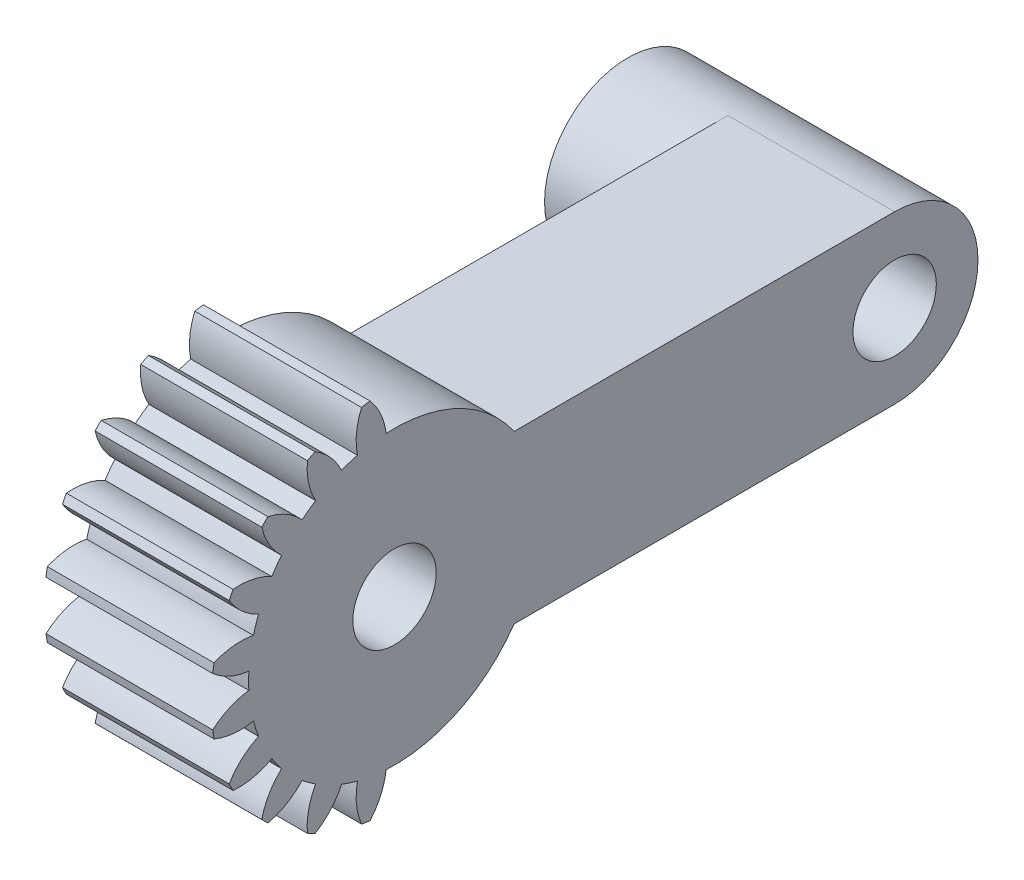
from build123d import *

# Parameters (mm, degrees)
SKETCH1_R           = 2.5
BOSS_EXTRUDE1_DEPTH = 10
SKETCH2_R           = 2.4999999999999947
BOSS_EXTRUDE2_DEPTH = 10
SKETCH3_R           = 5.000000000003233
SKETCH3_R_2         = 2.500000000003231
BOSS_EXTRUDE3_DEPTH = 6
SKETCH4_R           = 2.5
CUT_EXTRUDE1_DEPTH  = 5
SKETCH6_R           = 1.5
CUT_EXTRUDE2_DEPTH  = 40.40067248227502
CUT_EXTRUDE3_START  = -3
SKETCH7_R           = 2.5
CUT_EXTRUDE3_DEPTH  = 3
SKETCH8_R           = 4.500000000000001
SKETCH8_R_2         = 2.5
BOSS_EXTRUDE4_DEPTH = 2
CUT_EXTRUDE4_DEPTH  = 42.07813277226101


with BuildPart() as part:
    # Sketch1 → Boss-Extrude1 (new body)
    with BuildSketch(Plane(origin=(4.043870028605396, 0, 0), x_dir=(0, 0, -1), z_dir=(1, 0, 0))):
        with BuildLine():
            ThreePointArc((-10.029541992492211, 0.34287906907703786), (-9.019080639497046, -0.3040165410476918), (-7.862233613468845, -0.6221533585730625))
            ThreePointArc((-7.862233613468845, -0.6221533585730625), (-7.876528295787219, -1.1220773660625376), (-7.862233613468842, -1.6220013735520122))
            ThreePointArc((-7.862233613468842, -1.6220013735520122), (-9.01908063949704, -1.9401381910773923), (-10.0295419924922, -2.5870338012021286))
            ThreePointArc((-10.0295419924922, -2.5870338012021286), (-9.992100042333727, -2.8428564815050867), (-9.948655897254575, -3.097728507524821))
            ThreePointArc((-9.948655897254575, -3.097728507524821), (-8.787748305909016, -3.4007130626620636), (-7.589211720296526, -3.3457937651081373))
            ThreePointArc((-7.589211720296526, -3.3457937651081373), (-7.448321756853508, -3.825667049848957), (-7.280241691875969, -4.29670573505864))
            ThreePointArc((-7.280241691875969, -4.29670573505864), (-8.282158911185054, -4.956757219374386), (-9.043263028300421, -5.884241234980854))
            ThreePointArc((-9.043263028300421, -5.884241234980854), (-8.928600061859244, -6.115972863197567), (-8.808522437155974, -6.344945585229429))
            ThreePointArc((-8.808522437155974, -6.344945585229429), (-7.610806331019726, -6.274360846104827), (-6.487901297518119, -5.851761316961428))
            ThreePointArc((-6.487901297518119, -5.851761316961428), (-6.205617979573607, -6.264610538369388), (-5.900205379779585, -6.660655352871453))
            ThreePointArc((-5.900205379779585, -6.660655352871453), (-6.649118154175834, -7.598011065843629), (-7.086362861503959, -8.715294889323147))
            ThreePointArc((-7.086362861503959, -8.715294889323147), (-6.905702888839201, -8.900251959114573), (-6.720745819047777, -9.080911931779326))
            ThreePointArc((-6.720745819047777, -9.080911931779326), (-5.603461995568265, -8.64366722445119), (-4.666106282596096, -7.894754450054931))
            ThreePointArc((-4.666106282596096, -7.894754450054931), (-4.2700614680940285, -8.200167049848949), (-3.8572122466860654, -8.482450367793456))
            ThreePointArc((-3.8572122466860654, -8.482450367793456), (-4.279811775829452, -9.605355401295068), (-4.350396514954039, -10.803071507431317))
            ThreePointArc((-4.350396514954039, -10.803071507431317), (-4.121423792922173, -10.923149132134585), (-3.889692164705458, -11.03781209857576))
            ThreePointArc((-3.889692164705458, -11.03781209857576), (-2.962208149098999, -10.27670798146038), (-2.302156664783265, -9.274790762151289))
            ThreePointArc((-2.302156664783265, -9.274790762151289), (-1.8311179795735804, -9.44287082712882), (-1.3512446948327583, -9.583760790571835))
            ThreePointArc((-1.3512446948327583, -9.583760790571835), (-1.4061639923866718, -10.782297376184328), (-1.1031794372494148, -11.943204967529885))
            ThreePointArc((-1.1031794372494148, -11.943204967529885), (-0.8483074112296868, -11.986649112609033), (-0.5924847309267279, -12.024091062767505))
            ThreePointArc((-0.5924847309267279, -12.024091062767505), (0.0544108791979987, -11.013629709772339), (0.3725476967233653, -9.856782683744134))
            ThreePointArc((0.3725476967233653, -9.856782683744134), (0.8724717042128405, -9.871077366062506), (1.3723957117023153, -9.856782683744127))
            ThreePointArc((1.3723957117023153, -9.856782683744127), (1.6905325292276978, -11.013629709772324), (2.337428139352438, -12.024091062767482))
            ThreePointArc((2.337428139352438, -12.024091062767482), (2.5932508196553967, -11.986649112609008), (2.8481228456751295, -11.943204967529857))
            ThreePointArc((2.8481228456751295, -11.943204967529857), (3.151107400812369, -10.782297376184296), (3.096188103258439, -9.583760790571805))
            ThreePointArc((3.096188103258439, -9.583760790571805), (3.5760613879992595, -9.442870827128784), (4.0471000732089415, -9.274790762151245))
            ThreePointArc((4.0471000732089415, -9.274790762151245), (4.70715155752469, -10.276707981460325), (5.63463557313116, -11.037812098575692))
            ThreePointArc((5.63463557313116, -11.037812098575692), (5.866367201347875, -10.923149132134514), (6.09533992337974, -10.803071507431241))
            ThreePointArc((6.09533992337974, -10.803071507431241), (6.024755184255134, -9.605355401294993), (5.60215565511173, -8.482450367793389))
            ThreePointArc((5.60215565511173, -8.482450367793389), (6.015004876519687, -8.200167049848877), (6.411049691021751, -7.894754450054851))
            ThreePointArc((6.411049691021751, -7.894754450054851), (7.348405403993933, -8.643667224451097), (8.465689227473451, -9.080911931779216))
            ThreePointArc((8.465689227473451, -9.080911931779216), (8.650646297264876, -8.900251959114458), (8.83130626992963, -8.71529488932303))
            ThreePointArc((8.83130626992963, -8.71529488932303), (8.39406156260149, -7.5980110658435205), (7.645148788205225, -6.660655352871357))
            ThreePointArc((7.645148788205225, -6.660655352871357), (7.950561387999242, -6.264610538369286), (8.232844705943748, -5.851761316961323))
            ThreePointArc((8.232844705943748, -5.851761316961323), (9.355749739445361, -6.274360846104704), (10.553465845581611, -6.344945585229289))
            ThreePointArc((10.553465845581611, -6.344945585229289), (10.673543470284876, -6.1159728631974275), (10.788206436726048, -5.884241234980715))
            ThreePointArc((10.788206436726048, -5.884241234980715), (10.027102319610664, -4.956757219374257), (9.02518510030157, -4.296705735058527))
            ThreePointArc((9.02518510030157, -4.296705735058527), (9.1932651652791, -3.8256670498488425), (9.334155128722113, -3.34579376510802))
            ThreePointArc((9.334155128722113, -3.34579376510802), (10.532691714334605, -3.400713062661929), (11.693599305680165, -3.0977285075246694))
            ThreePointArc((11.693599305680165, -3.0977285075246694), (11.737043450759314, -2.842856481504939), (11.774485400917783, -2.587033801201977))
            ThreePointArc((11.774485400917783, -2.587033801201977), (10.764024047922613, -1.9401381910772533), (9.607177021894408, -1.6220013735518914))
            ThreePointArc((9.607177021894408, -1.6220013735518914), (9.621471704212778, -1.1220773660624164), (9.607177021894397, -0.6221533585729416))
            ThreePointArc((9.607177021894397, -0.6221533585729416), (10.764024047922593, -0.30401654104755416), (11.774485400917749, 0.3428790690771896))
            ThreePointArc((11.774485400917749, 0.3428790690771896), (11.737043450759273, 0.598701749380151), (11.69359930568012, 0.8535737753998818))
            ThreePointArc((11.69359930568012, 0.8535737753998818), (10.53269171433456, 1.1565583305371163), (9.334155128722069, 1.101639032983181))
            ThreePointArc((9.334155128722069, 1.101639032983181), (9.193265165279046, 1.5815123177240011), (9.025185100301504, 2.0525510029336824))
            ThreePointArc((9.025185100301504, 2.0525510029336824), (10.027102319610583, 2.7126024872494354), (10.788206436725947, 3.6400865028559086))
            ThreePointArc((10.788206436725947, 3.6400865028559086), (10.673543470284766, 3.871818131072623), (10.553465845581496, 4.1007908531044865))
            ThreePointArc((10.553465845581496, 4.1007908531044865), (9.355749739445246, 4.030206113979876), (8.232844705943643, 3.607606584836468))
            ThreePointArc((8.232844705943643, 3.607606584836468), (7.950561387999129, 4.020455806244425), (7.645148788205104, 4.416500620746487))
            ThreePointArc((7.645148788205104, 4.416500620746487), (8.394061562601348, 5.353856333718671), (8.831306269929463, 6.4711401571981915))
            ThreePointArc((8.831306269929463, 6.4711401571981915), (8.650646297264704, 6.656097226989614), (8.465689227473275, 6.836757199654366))
            ThreePointArc((8.465689227473275, 6.836757199654366), (7.348405403993766, 6.399512492326222), (6.411049691021604, 5.650599717929957))
            ThreePointArc((6.411049691021604, 5.650599717929957), (6.015004876519532, 5.956012317723974), (5.602155655111568, 6.238295635668477))
            ThreePointArc((5.602155655111568, 6.238295635668477), (6.024755184254946, 7.361200669170091), (6.095339923379528, 8.558916775306342))
            ThreePointArc((6.095339923379528, 8.558916775306342), (5.866367201347666, 8.678994400009604), (5.6346355731309545, 8.793657366450777))
            ThreePointArc((5.6346355731309545, 8.793657366450777), (4.707151557524499, 8.03255324933539), (4.047100073208772, 7.030636030026296))
            ThreePointArc((4.047100073208772, 7.030636030026296), (3.576061387999086, 7.198716095003826), (3.096188103258263, 7.339606058446835))
            ThreePointArc((3.096188103258263, 7.339606058446835), (3.151107400812168, 8.538142644059327), (2.848122845674904, 9.699050235404883))
            ThreePointArc((2.848122845674904, 9.699050235404883), (2.59325081965525, 9.742494380484018), (2.337428139352364, 9.77993633064248))
            ThreePointArc((2.337428139352364, 9.77993633064248), (1.6905325292276303, 8.769474977647317), (1.3723957117022554, 7.612627951619116))
            ThreePointArc((1.3723957117022554, 7.612627951619116), (0.8724717042127803, 7.62692263393749), (0.37254769672330534, 7.612627951619116))
            ThreePointArc((0.37254769672330534, 7.612627951619116), (0.05441087919792942, 8.769474977647317), (-0.5924847309268042, 9.77993633064248))
            ThreePointArc((-0.5924847309268042, 9.77993633064248), (-0.8483074112297638, 9.742494380484008), (-1.1031794372494936, 9.699050235404856))
            ThreePointArc((-1.1031794372494936, 9.699050235404856), (-1.4061639923867406, 8.538142644059297), (-1.3512446948328194, 7.339606058446805))
            ThreePointArc((-1.3512446948328194, 7.339606058446805), (-1.8311179795736416, 7.198716095003787), (-2.3021566647833245, 7.030636030026252))
            ThreePointArc((-2.3021566647833245, 7.030636030026252), (-2.9622081490990655, 8.032553249335336), (-3.889692164705529, 8.79365736645071))
            ThreePointArc((-3.889692164705529, 8.79365736645071), (-4.121423792922243, 8.678994400009532), (-4.350396514954109, 8.558916775306265))
            ThreePointArc((-4.350396514954109, 8.558916775306265), (-4.2798117758295104, 7.361200669170017), (-3.8572122466861165, 6.23829563566841))
            ThreePointArc((-3.8572122466861165, 6.23829563566841), (-4.270061468094076, 5.9560123177239), (-4.666106282596143, 5.650599717929878))
            ThreePointArc((-4.666106282596143, 5.650599717929878), (-5.603461995568316, 6.39951249232613), (-6.72074581904783, 6.836757199654257))
            ThreePointArc((-6.72074581904783, 6.836757199654257), (-6.905702888839254, 6.656097226989501), (-7.086362861504012, 6.471140157198077))
            ThreePointArc((-7.086362861504012, 6.471140157198077), (-6.64911815417588, 5.353856333718562), (-5.9002053797796234, 4.416500620746391))
            ThreePointArc((-5.9002053797796234, 4.416500620746391), (-6.205617979573644, 4.020455806244323), (-6.487901297518152, 3.6076065848363625))
            ThreePointArc((-6.487901297518152, 3.6076065848363625), (-7.610806331019762, 4.0302061139797525), (-8.808522437156011, 4.100790853104347))
            ThreePointArc((-8.808522437156011, 4.100790853104347), (-8.92860006185928, 3.871818131072482), (-9.043263028300455, 3.6400865028557656))
            ThreePointArc((-9.043263028300455, 3.6400865028557656), (-8.282158911185078, 2.712602487249305), (-7.280241691875992, 2.052551002933568))
            ThreePointArc((-7.280241691875992, 2.052551002933568), (-7.448321756853527, 1.5815123177238826), (-7.589211720296541, 1.101639032983062))
            ThreePointArc((-7.589211720296541, 1.101639032983062), (-8.787748305909032, 1.1565583305369795), (-9.94865589725459, 0.8535737753997278))
            ThreePointArc((-9.94865589725459, 0.8535737753997278), (-9.992100042333739, 0.5987017493799944), (-10.029541992492211, 0.34287906907703786))
        make_face()
        with Locations((0.8724717042127798, -1.1220773660625076)):
            Circle(SKETCH1_R, mode=Mode.SUBTRACT)
    extrude(amount=-BOSS_EXTRUDE1_DEPTH)

    # Sketch2 → Boss-Extrude2 (add)
    with BuildSketch(Plane(origin=(4.043870028605396, 0, 0), x_dir=(0, 0, -1), z_dir=(1, 0, 0))):
        with BuildLine():
            Line((30.872471704212778, 3.8779226339374926), (0.8724717042127798, 3.8779226339374926))
            ThreePointArc((0.8724717042127798, 3.8779226339374926), (-4.127528295787222, -1.1220773660625067), (0.8724717042127784, -6.122077366062507))
            Line((0.8724717042127798, -6.122077366062507), (30.872471704212778, -6.122077366062507))
            ThreePointArc((30.872471704212778, -6.122077366062507), (34.33102632468052, -4.732949828119457), (35.8678315592395, -1.3374373409589966))
            ThreePointArc((35.8678315592395, -1.3374373409589966), (35.87247170421278, -1.1220773660625074), (35.8678315592395, -0.9067173911660183))
            ThreePointArc((35.8678315592395, -0.906717391166018), (34.33102632468052, 2.4887950959944427), (30.872471704212778, 3.877922633937493))
        make_face()
        with Locations((30.872471704212778, -1.1220773660625076)):
            Circle(SKETCH2_R, mode=Mode.SUBTRACT)
    extrude(amount=-BOSS_EXTRUDE2_DEPTH)

    # Sketch3 → Boss-Extrude3 (add)
    with BuildSketch(Plane.ZY.offset(5.956129971394604)):
        with Locations((-30.872471704212778, -1.1220773660625076)):
            Circle(SKETCH3_R)
        with Locations((-30.872471704212778, -1.1220773660625076)):
            Circle(SKETCH3_R_2, mode=Mode.SUBTRACT)
    extrude(amount=BOSS_EXTRUDE3_DEPTH)

    # Sketch4 → Cut-Extrude1 (cut)
    with BuildSketch(Plane(origin=(4.043870028605396, 0, 0), x_dir=(0, 0, -1), z_dir=(1, 0, 0))):
        with Locations((0.8724717042127798, -1.1220773660625076)):
            Circle(SKETCH4_R)
    extrude(amount=-CUT_EXTRUDE1_DEPTH, mode=Mode.SUBTRACT)

    # Sketch6 → Cut-Extrude2 (cut, through all)
    with BuildSketch(Plane(origin=(-0.9561299713946037, 0, 0), x_dir=(0, 0, -1), z_dir=(1, 0, 0))):
        with Locations((0.8724717042127798, -1.1220773660625076)):
            Circle(SKETCH6_R)
    extrude(amount=-CUT_EXTRUDE2_DEPTH, mode=Mode.SUBTRACT)

    # Sketch7 → Cut-Extrude3 (cut)
    with BuildSketch(Plane.ZY.offset(5.956129971394604).offset(CUT_EXTRUDE3_START)):
        with Locations((-0.8724717042127798, -1.1220773660625076)):
            Circle(SKETCH7_R)
    extrude(amount=CUT_EXTRUDE3_DEPTH, mode=Mode.SUBTRACT)

    # Sketch8 → Boss-Extrude4 (add)
    with BuildSketch(Plane.ZY.offset(5.956129971394604)):
        with Locations((-0.8724717042127798, -1.1220773660625076)):
            Circle(SKETCH8_R)
        with Locations((-0.8724717042127798, -1.1220773660625076)):
            Circle(SKETCH8_R_2, mode=Mode.SUBTRACT)
    extrude(amount=BOSS_EXTRUDE4_DEPTH)

    # Sketch9 → Cut-Extrude4 (cut, through all)
    with BuildSketch(Plane(origin=(4.043870028605396, 0, 0), x_dir=(0, 0, -1), z_dir=(1, 0, 0))):
        with BuildLine():
            Line((11.302349514928816, -6.122077366062507), (8.051956435027378, -6.122077366062507))
            ThreePointArc((8.051956435027378, -6.122077366062507), (4.922163112209195, -8.877398152464576), (0.8724717042127798, -9.871077366062506))
            Line((0.8724717042127798, -9.871077366062506), (0.8724717042127798, -12.688509449746167))
            ThreePointArc((0.8724717042127798, -12.688509449746167), (7.03486534337802, -10.910195458037212), (11.302349514928816, -6.122077366062507))
        make_face()
        with BuildLine():
            Line((11.302349514928816, 3.8779226339374926), (8.051956435027378, 3.8779226339374926))
            ThreePointArc((8.051956435027378, 3.8779226339374926), (4.922163112209195, 6.633243420339561), (0.8724717042127798, 7.6269226339374905))
            Line((0.8724717042127798, 7.6269226339374905), (0.8724717042127798, 10.444354717621152))
            ThreePointArc((0.8724717042127798, 10.444354717621152), (7.03486534337802, 8.666040725912197), (11.302349514928816, 3.8779226339374926))
        make_face()
    extrude(amount=-CUT_EXTRUDE4_DEPTH, mode=Mode.SUBTRACT)


solid = part.part
